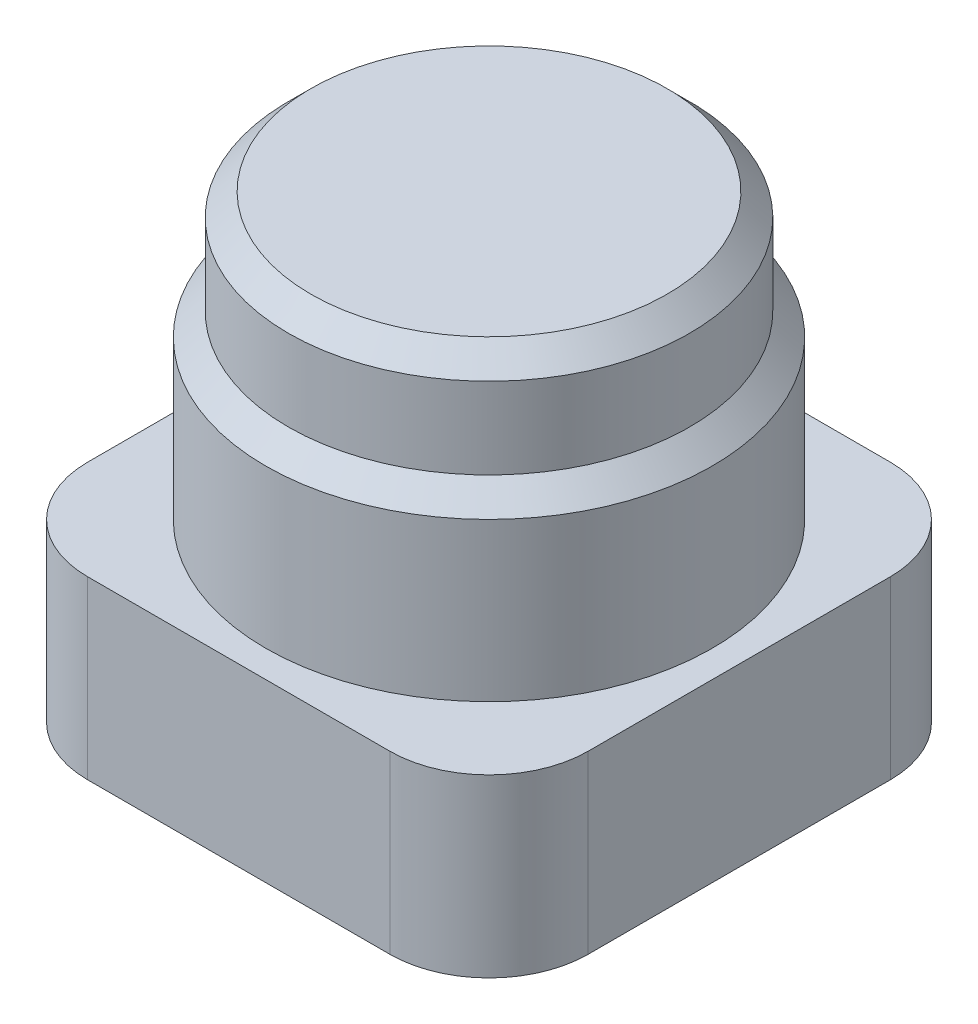
from build123d import *

# Parameters (mm, degrees)
BOSS_EXTRUDE1_DEPTH = 19.5
SKETCH2_R           = 24.75
BOSS_EXTRUDE2_DEPTH = 17.5
SKETCH3_R           = 22.25
BOSS_EXTRUDE3_DEPTH = 14
FILLET1_SIZE        = 2.5
SKETCH4_R           = 1.25
SKETCH4_R_2         = 1.025
CUT_EXTRUDE1_DEPTH  = 6


with BuildPart() as part:
    # Sketch1 → Boss-Extrude1 (new body)
    with BuildSketch(Plane(origin=(0, 0, 0), x_dir=(1, 0, 0), z_dir=(0, 1, 0))):
        with BuildLine():
            Line((-16.75, -27.75), (16.75, -27.75))
            ThreePointArc((16.75, -27.75), (24.528174593, -24.528174593), (27.75, -16.75))
            Line((27.75, -16.75), (27.75, 16.75))
            ThreePointArc((27.75, 16.75), (24.528174593, 24.528174593), (16.75, 27.75))
            Line((16.75, 27.75), (-16.75, 27.75))
            ThreePointArc((-16.75, 27.75), (-24.528174593, 24.528174593), (-27.75, 16.75))
            Line((-27.75, 16.75), (-27.75, -16.75))
            ThreePointArc((-27.75, -16.75), (-24.528174593, -24.528174593), (-16.75, -27.75))
        make_face()
    extrude(amount=BOSS_EXTRUDE1_DEPTH)

    # Sketch2 → Boss-Extrude2 (add)
    with BuildSketch(Plane(origin=(0, 19.5, 0), x_dir=(1, 0, 0), z_dir=(0, 1, 0))):
        with Locations(Location((0, 0, 0), (0, 0, 270))):
            Circle(SKETCH2_R)
    extrude(amount=BOSS_EXTRUDE2_DEPTH)

    # Sketch3 → Boss-Extrude3 (add)
    with BuildSketch(Plane(origin=(0, 37, 0), x_dir=(1, 0, 0), z_dir=(0, 1, 0))):
        with Locations(Location((0, 0, 0), (0, 0, 270))):
            Circle(SKETCH3_R)
    extrude(amount=BOSS_EXTRUDE3_DEPTH)

    # Fillet1
    fillet1_edges = [part.edges().sort_by_distance(p)[0] for p in [
        (0, 37, -22.25),
        (0, 51, -22.25),
    ]]
    chamfer(fillet1_edges, length=FILLET1_SIZE - 0.0001)  # a hair under: the kernel refuses the full size

    # Sketch4 → Cut-Extrude1 (cut)
    with BuildSketch(Plane.XZ):
        with Locations(Location((21.5, 21.5, 0), (0, 0, 270))):
            Circle(SKETCH4_R)
        with Locations(Location((25, 0, 0), (0, 0, 270))):
            Circle(SKETCH4_R_2)
        with Locations(Location((21.5, -21.5, 0), (0, 0, 90))):
            Circle(SKETCH4_R)
        with Locations(Location((-21.5, -21.5, 0), (0, 0, 270))):
            Circle(SKETCH4_R)
        with Locations(Location((-25, 0, 0), (0, 0, 90))):
            Circle(SKETCH4_R_2)
        with Locations(Location((-21.5, 21.5, 0), (0, 0, 90))):
            Circle(SKETCH4_R)
    extrude(amount=-CUT_EXTRUDE1_DEPTH, mode=Mode.SUBTRACT)


solid = part.part
